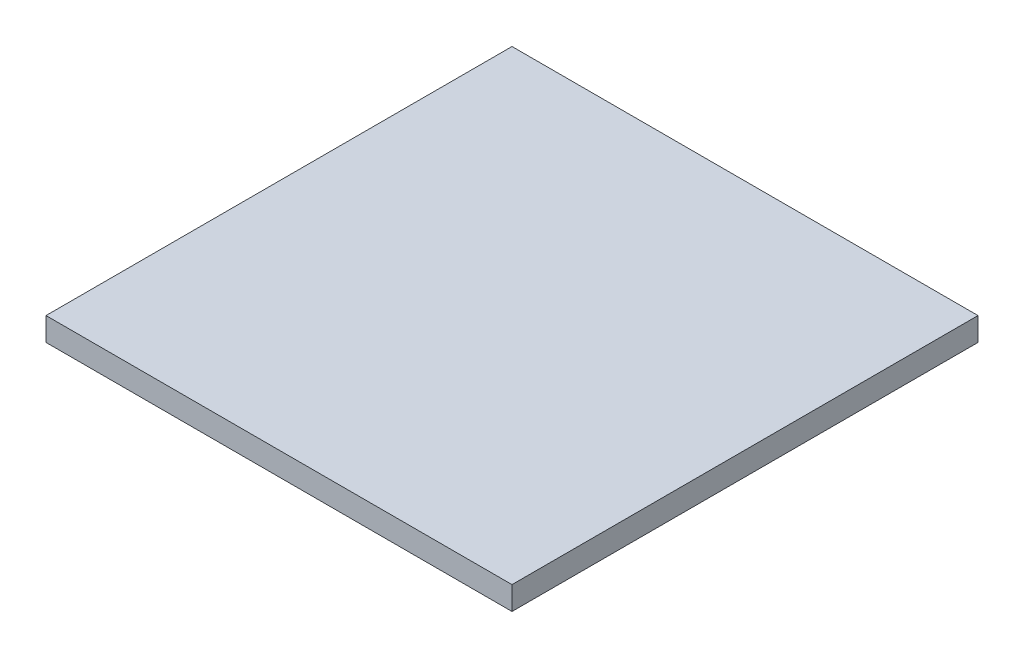
from build123d import *

# Parameters (mm, degrees)
SKETCH1_W           = 200
SKETCH1_H           = 10
BOSS_EXTRUDE1_DEPTH = 100


with BuildPart() as part:
    # Sketch1 → Boss-Extrude1 (new, symmetric)
    with BuildSketch(Plane.XY):
        with Locations((-100, 0)):
            Rectangle(SKETCH1_W, SKETCH1_H)
    extrude(amount=BOSS_EXTRUDE1_DEPTH, both=True)


solid = part.part
